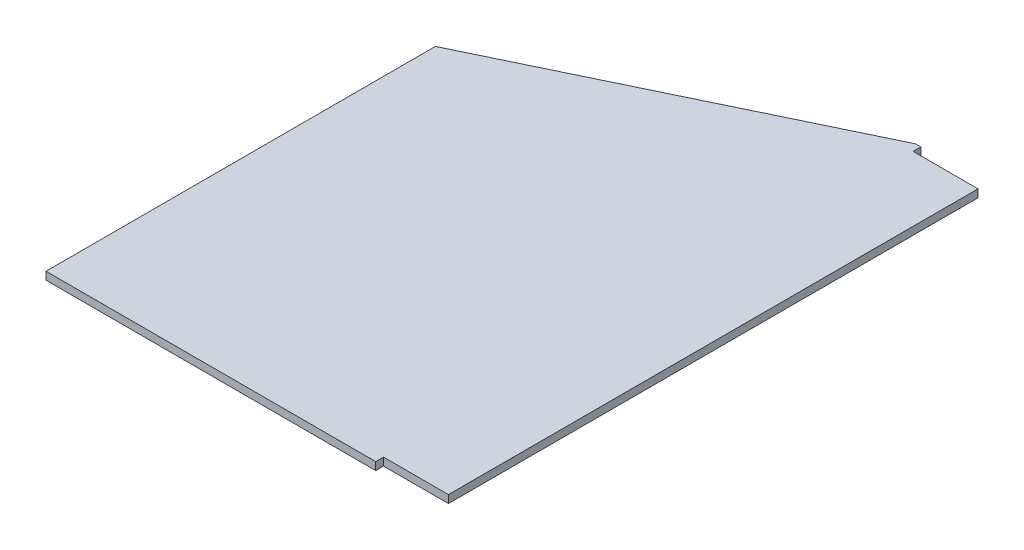
from build123d import *

# Parameters (mm, degrees)
BOSS_EXTRUDE1_DEPTH      = 1.5
BOSS_EXTRUDE1_DEPTH_BACK = 1.5
SKETCH2_R                = 51.2
CUT_EXTRUDE1_DEPTH       = 245.391591508
SKETCH3_R                = 76.2
CUT_EXTRUDE2_DEPTH       = 3
CUT_EXTRUDE3_START       = -3
SKETCH4_R                = 76.2
CUT_EXTRUDE3_DEPTH       = 3


with BuildPart() as part:
    # Sketch1 → Boss-Extrude1 (new, two sides: drawn at the far end of the back side and taken through both)
    with BuildSketch(Plane(origin=(0, 0, 0), x_dir=(1, 0, 0), z_dir=(0, 1, 0)).offset(-BOSS_EXTRUDE1_DEPTH_BACK)):
        Polygon((-125, 150), (-125, 0), (0, 0), (78.2, 0), (78.2, 210), (0, 210), align=None)
    extrude(amount=BOSS_EXTRUDE1_DEPTH + BOSS_EXTRUDE1_DEPTH_BACK)

    # Sketch2 → Cut-Extrude1 (cut, through all)
    with BuildSketch(Plane(origin=(0, 0, -210), x_dir=(-1, 0, 0), z_dir=(0, 0, -1))):
        with Locations((-78.2, 0)):
            Circle(SKETCH2_R)
    extrude(amount=-CUT_EXTRUDE1_DEPTH, mode=Mode.SUBTRACT)

    # Sketch3 → Cut-Extrude2 (cut)
    with BuildSketch(Plane(origin=(0, 0, -210), x_dir=(-1, 0, 0), z_dir=(0, 0, -1))):
        with Locations((-78.2, 0)):
            Circle(SKETCH3_R)
    extrude(amount=-CUT_EXTRUDE2_DEPTH, mode=Mode.SUBTRACT)

    # Sketch4 → Cut-Extrude3 (cut)
    with BuildSketch(Plane.XY.offset(CUT_EXTRUDE3_START)):
        with Locations((78.2, 0)):
            Circle(SKETCH4_R)
    extrude(amount=CUT_EXTRUDE3_DEPTH, mode=Mode.SUBTRACT)


solid = part.part
